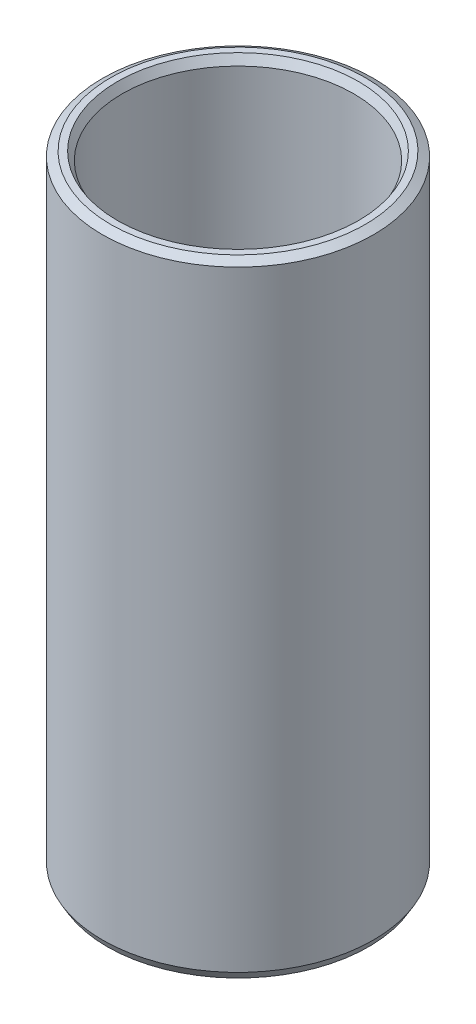
from build123d import *
from OCP.BRepFilletAPI import BRepFilletAPI_MakeChamfer

# Parameters (mm, degrees)
SKETCH1_R           = 45
BOSS_EXTRUDE1_DEPTH = 207.154820421
SKETCH2_R           = 38.440885013
CUT_EXTRUDE1_DEPTH  = 217.709758949
CHAMFER1_SIZE       = 1.581529259
CHAMFER1_SIZE2      = 2.73928903


with BuildPart() as part:
    # Sketch1 → Boss-Extrude1 (new body)
    with BuildSketch(Plane(origin=(0, 0, 0), x_dir=(1, 0, 0), z_dir=(0, 1, 0))):
        Circle(SKETCH1_R)
    extrude(amount=BOSS_EXTRUDE1_DEPTH)

    # Sketch2 → Cut-Extrude1 (cut, through all)
    with BuildSketch(Plane(origin=(0, 0, 0), x_dir=(1, 0, 0), z_dir=(0, 1, 0))):
        Circle(SKETCH2_R)
    extrude(amount=CUT_EXTRUDE1_DEPTH, mode=Mode.SUBTRACT)

    # Chamfer1: one chamfer whose edges measure the first distance from different faces: ONE call of the kernel's chamfer builder (chamfer() names one face for all edges)
    chamfer1_edges_1 = [part.edges().sort_by_distance(p)[0] for p in [
        (-38.440885013, 207.154820421, 0),
    ]]
    chamfer1_side_1 = [part.faces().sort_by_distance(p)[0] for p in [
        (-43.727207794, 207.154820421, 0),
    ]]
    chamfer1_edges_2 = [part.edges().sort_by_distance(p)[0] for p in [
        (-38.440885013, 0, 0),
    ]]
    chamfer1_side_2 = [part.faces().sort_by_distance(p)[0] for p in [
        (-38.440885013, 103.577410211, 0),
    ]]
    chamfer1_edges_3 = [part.edges().sort_by_distance(p)[0] for p in [
        (-45, 0, 0),
    ]]
    chamfer1_side_3 = [part.faces().sort_by_distance(p)[0] for p in [
        (-43.727207794, 0, 0),
    ]]
    chamfer1_edges_4 = [part.edges().sort_by_distance(p)[0] for p in [
        (-45, 207.154820421, 0),
    ]]
    chamfer1_side_4 = [part.faces().sort_by_distance(p)[0] for p in [
        (-45, 103.577410211, 0),
    ]]
    chamfer1 = BRepFilletAPI_MakeChamfer(part.part.solid().wrapped)
    for e in chamfer1_edges_1:
        chamfer1.Add(CHAMFER1_SIZE, CHAMFER1_SIZE2, e.wrapped, chamfer1_side_1[0].wrapped)  # the first distance lies on this face
    for e in chamfer1_edges_2:
        chamfer1.Add(CHAMFER1_SIZE, CHAMFER1_SIZE2, e.wrapped, chamfer1_side_2[0].wrapped)  # the first distance lies on this face
    for e in chamfer1_edges_3:
        chamfer1.Add(CHAMFER1_SIZE, CHAMFER1_SIZE2, e.wrapped, chamfer1_side_3[0].wrapped)  # the first distance lies on this face
    for e in chamfer1_edges_4:
        chamfer1.Add(CHAMFER1_SIZE, CHAMFER1_SIZE2, e.wrapped, chamfer1_side_4[0].wrapped)  # the first distance lies on this face
    add(Compound.cast(chamfer1.Shape()), mode=Mode.REPLACE)


solid = part.part
